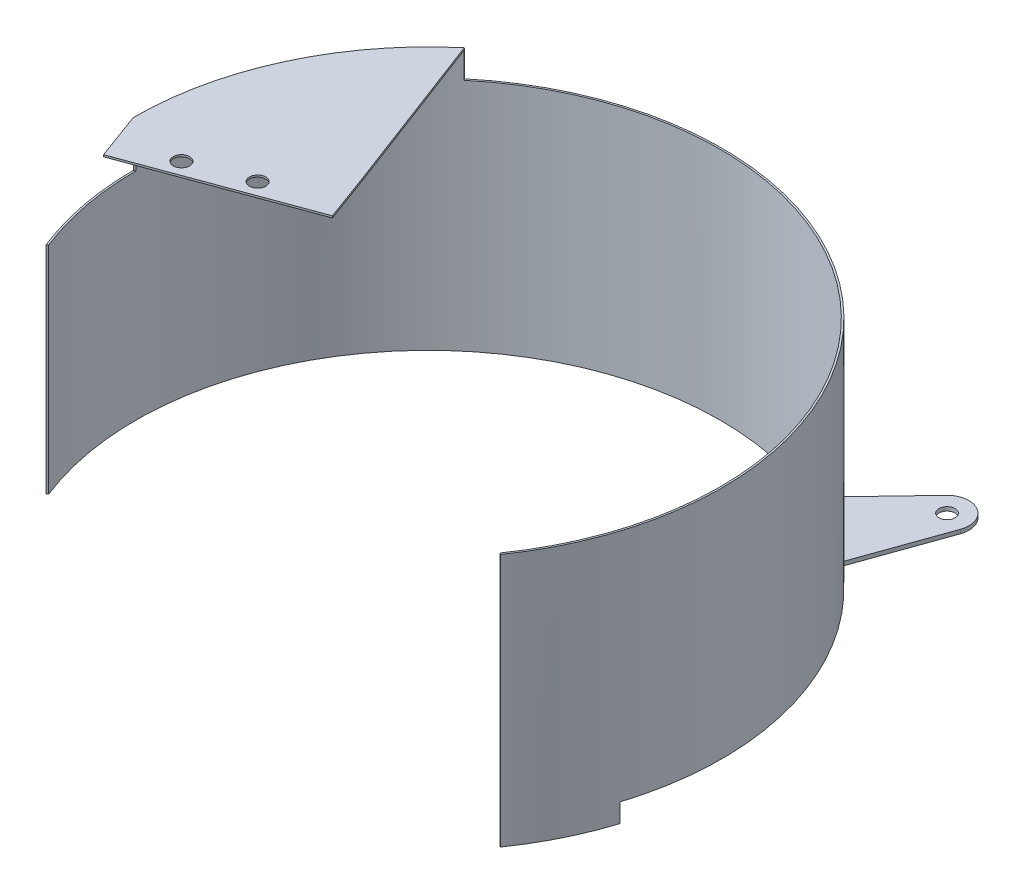
from build123d import *
from build123d.topology import SkipClean

# Parameters (mm, degrees)
BASE_FLANGE1_DEPTH   = 102.87
CUT_EXTRUDE1_START   = -7.62
CUT_EXTRUDE1_DEPTH   = 7.62
BOSS_EXTRUDE5_START  = -95.25
BOSS_EXTRUDE5_DEPTH  = 95.25
BOSS_EXTRUDE6_DEPTH  = 10.16
BOSS_EXTRUDE7_DEPTH  = 0.762
SKETCH12_W           = 72.378245623
SKETCH12_H           = 0.762
BOSS_EXTRUDE8_DEPTH  = 20.33854962
SKETCH13_R           = 3.3
CUT_EXTRUDE2_DEPTH   = 204.597121983
SKETCH15_R           = 3.2639
BOSS_EXTRUDE10_DEPTH = 1.5875
BOSS_EXTRUDE11_START = 17.78
BOSS_EXTRUDE11_DEPTH = 87.63


# Read off the part's stored shape, not the designer's step: Cut-Extrude1
# Sheet-metal steps are written as plain solids
with BuildPart() as part:
    # Sketch2 → Base-Flange1 (new body)
    with BuildSketch(Plane(origin=(0, 0, 0), x_dir=(1, 0, 0), z_dir=(0, 1, 0))):
        with BuildLine():
            ThreePointArc((-119.38, 0), (35.898258345, 113.85472958), (97.790371047, -68.473554972))
            Line((97.790371047, -68.473554972), (97.186983651, -68.051058569))
            ThreePointArc((97.186983651, -68.051058569), (35.676758453, 113.152221674), (-118.6434, 0))
            Line((-118.6434, 0), (-119.38, 0))
        make_face()
    extrude(amount=BASE_FLANGE1_DEPTH)

    # Cut-Extrude1 outline → Cut-Extrude1 (cut)
    with BuildSketch(Plane.XZ.offset(CUT_EXTRUDE1_START)):
        with BuildLine():
            ThreePointArc((-119.38, 0), (18.160489843, -117.990597119), (113.85472958, 35.898258345))
            Line((113.85472958, 35.898258345), (113.152221674, 35.676758453))
            ThreePointArc((113.152221674, 35.676758453), (18.048435757, -117.262570031), (-118.6434, 0))
            Line((-118.6434, 0), (-119.38, 0))
        make_face()
    extrude(amount=CUT_EXTRUDE1_DEPTH, mode=Mode.SUBTRACT)

    # Sketch9 → Boss-Extrude5 (add)
    with BuildSketch(Plane(origin=(0, 102.87, 0), x_dir=(1, 0, 0), z_dir=(0, 1, 0)).offset(BOSS_EXTRUDE5_START)):
        with BuildLine():
            Line((-119.379693576, -0.270484204), (-118.6434, 0))
            Line((-118.6434, 0), (-119.38, 0))
            ThreePointArc((-119.38, 0), (-119.379923394, -0.135242189), (-119.379693576, -0.270484204))
        make_face()
    extrude(amount=BOSS_EXTRUDE5_DEPTH)

    # Sketch10 → Boss-Extrude6 (add)
    with SkipClean():  # the faces are left unmerged after this step: merging them gives an invalid solid
        with BuildSketch(Plane(origin=(0, 102.87, 0), x_dir=(1, 0, 0), z_dir=(0, 1, 0))):
            with BuildLine():
                Line((-119.379693576, -0.270484204), (-118.6434, 0))
                ThreePointArc((-118.6434, 0), (-107.527437301, 50.140867475), (-76.262507491, 90.886117283))
                Line((-76.262507491, 90.886117283), (-76.735984844, 91.45038562))
                ThreePointArc((-76.735984844, 91.45038562), (-108.252110006, 50.329564663), (-119.379693576, -0.270484204))
            make_face()
        extrude(amount=BOSS_EXTRUDE6_DEPTH)

    # Sketch11 → Boss-Extrude7 (add)
    with SkipClean():  # the faces are left unmerged after this step: merging them gives an invalid solid
        with BuildSketch(Plane(origin=(0, 113.03, 0), x_dir=(1, 0, 0), z_dir=(0, 1, 0))):
            with BuildLine():
                Line((-119.379693576, -0.270484204), (-51.440692331, 24.687531528))
                Line((-51.440692331, 24.687531528), (-76.735984844, 91.45038562))
                ThreePointArc((-76.735984844, 91.45038562), (-108.252110006, 50.329564663), (-119.379693576, -0.270484204))
            make_face()
        extrude(amount=BOSS_EXTRUDE7_DEPTH)

    # Sketch12 → Boss-Extrude8 (add)
    with SkipClean():  # the faces are left unmerged after this step: merging them gives an invalid solid
        with BuildSketch(Plane(origin=(-14.107419738, 0, -38.402251904), x_dir=(0.9386660406079884, 0, -0.3448275862069655), z_dir=(0.3448275862069655, 0, 0.9386660406079884))):
            with Locations((-75.961811901, 113.411)):
                Rectangle(SKETCH12_W, SKETCH12_H)
        extrude(amount=BOSS_EXTRUDE8_DEPTH)

    # Sketch13 → Cut-Extrude2 (cut, through all)
    with SkipClean():  # the faces are left unmerged after this step: merging them gives an invalid solid
        with BuildSketch(Plane(origin=(0, 113.792, 0), x_dir=(1, 0, 0), z_dir=(0, 1, 0))):
            with Locations(Location((-94.258662261, -5.860928581, 0), (0, 0, 270))):
                Circle(SKETCH13_R)
            with Locations(Location((-71.633967235, 2.450493285, 0), (0, 0, 270))):
                Circle(SKETCH13_R)
        extrude(amount=-CUT_EXTRUDE2_DEPTH, mode=Mode.SUBTRACT)

    # Sketch15 → Boss-Extrude10 (add)
    with SkipClean():  # the faces are left unmerged after this step: merging them gives an invalid solid
        with BuildSketch(Plane.XZ.offset(-7.62)):
            with BuildLine():
                Line((76.054879624, -92.017605302), (88.669451617, -127.404882133))
                ThreePointArc((88.669451617, -127.404882133), (84.957156503, -137.959730204), (73.860989671, -136.524099874))
                Line((73.860989671, -136.524099874), (47.938477772, -109.332002401))
                ThreePointArc((47.938477772, -109.332002401), (62.598204897, -101.651606695), (76.054879624, -92.017605302))
            make_face()
            with Locations(Location((80.295588053, -130.389929705, 0), (0, 0, 270))):
                Circle(SKETCH15_R, mode=Mode.SUBTRACT)
        extrude(amount=-BOSS_EXTRUDE10_DEPTH)

    # Sketch16 → Boss-Extrude11 (add)
    with SkipClean():  # the faces are left unmerged after this step: merging them gives an invalid solid
        with BuildSketch(Plane.XZ.offset(-113.03).offset(BOSS_EXTRUDE11_START)):
            with BuildLine():
                Line((-119.379693576, 0.270484204), (-118.6434, 0))
                ThreePointArc((-118.6434, 0), (-116.541899203, 22.231556259), (-110.311843526, 43.675548554))
                Line((-110.311843526, 43.675548554), (-110.896860103, 44.19808615))
                ThreePointArc((-110.896860103, 44.19808615), (-117.21446731, 22.635217102), (-119.379693576, 0.270484204))
            make_face()
        extrude(amount=BOSS_EXTRUDE11_DEPTH)


solid = part.part
